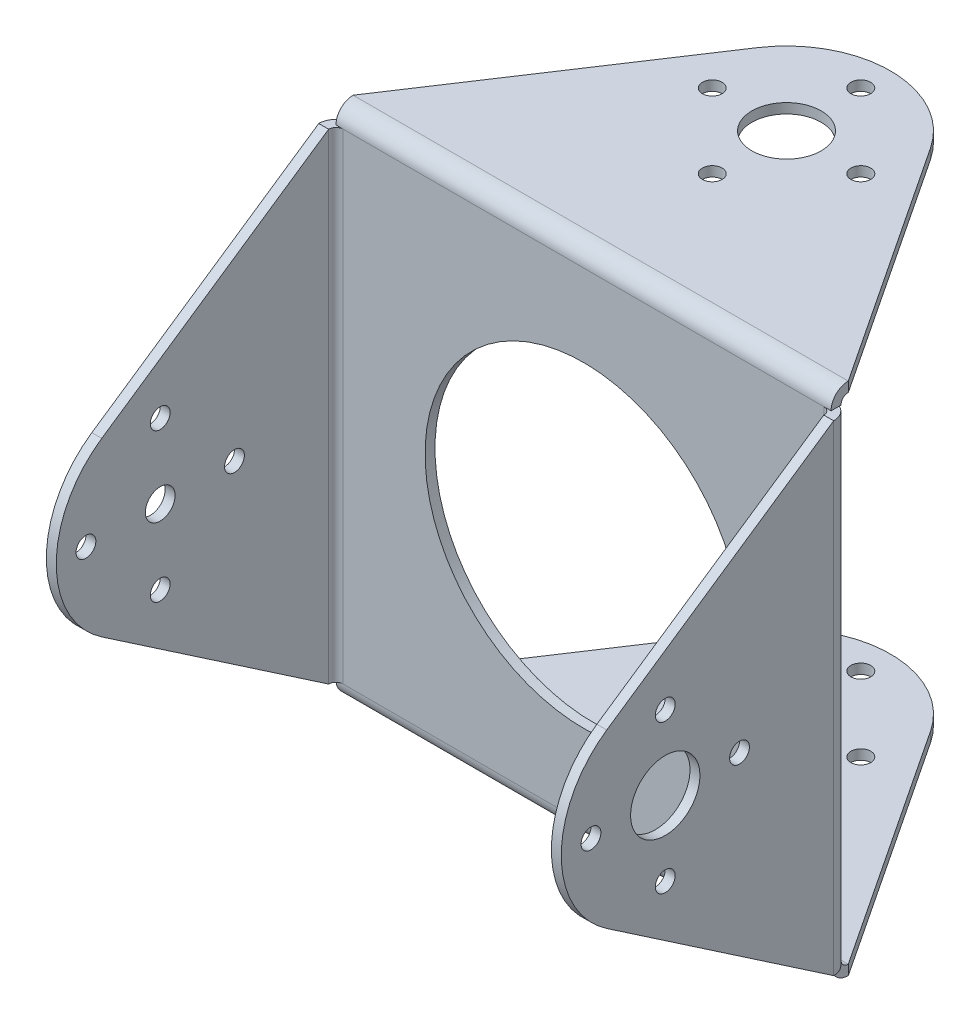
from build123d import *

# Parameters (mm, degrees)
SKETCH_1_W                         = 50
SKETCH_1_H                         = 50
SKETCH_1_R                         = 16
SM_BASE_FLANGE_1_DEPTH             = 1
SM_EDGE_FLANGE_1_STRIP_W           = 5.4732
SM_EDGE_FLANGE_1_STRIP_H           = 1
SM_EDGE_FLANGE_1_STRIP_CUT_DEPTH   = 50
SM_EDGE_FLANGE_1_STRIP_2_W         = 5.4732
SM_EDGE_FLANGE_1_STRIP_2_H         = 1
SM_EDGE_FLANGE_1_STRIP_CUT_2_DEPTH = 50
SM_EDGE_FLANGE_1_DEPTH             = 50
SM_EDGE_FLANGE_1_BEND_DEPTH        = 50
SM_EDGE_FLANGE_2_STRIP_W           = 5.4732
SM_EDGE_FLANGE_2_STRIP_H           = 1
SM_EDGE_FLANGE_2_STRIP_CUT_DEPTH   = 48.5268
SM_EDGE_FLANGE_2_STRIP_2_W         = 5.4732
SM_EDGE_FLANGE_2_STRIP_2_H         = 1
SM_EDGE_FLANGE_2_STRIP_CUT_2_DEPTH = 48.5268
SM_EDGE_FLANGE_2_DEPTH             = 48.5268
SM_EDGE_FLANGE_2_BEND_DEPTH        = 48.5268
SKETCH_23_R                        = 1
CUT_EXTRUDE_1_DEPTH                = 98
CUT_EXTRUDE_3_REACH                = 67.886
SKETCH_27_R                        = 3.5
SKETCH_27_R_2                      = 1
EXTRUDE_START                      = -1
SKETCH_30_R                        = 3.5
SKETCH_30_R_2                      = 1.5
EXTRUDE_1_DEPTH                    = 1
SKETCH_33_R                        = 3.5
EXTRUDE_2_DEPTH                    = 1
SKETCH_36_R                        = 1.5
CUT_EXTRUDE_4_DEPTH                = 1


# Sheet-metal steps are written as plain solids
with BuildPart() as part:
    # Sketch 1 → 基材-凸緣1 (new body)
    with BuildSketch(Plane.XY):
        Rectangle(SKETCH_1_W, SKETCH_1_H)
        Circle(SKETCH_1_R, mode=Mode.SUBTRACT)
    extrude(amount=-SM_BASE_FLANGE_1_DEPTH)

    # 邊線-凸緣1 strip (across the edge) → 邊線-凸緣1 strip cut (cut)
    with BuildSketch(Plane(origin=(-25, 25, -1), x_dir=(0, -1, 0), z_dir=(1, 0, 0))):
        with Locations((-2, -0.5)):
            Rectangle(SM_EDGE_FLANGE_1_STRIP_W, SM_EDGE_FLANGE_1_STRIP_H)
    extrude(amount=SM_EDGE_FLANGE_1_STRIP_CUT_DEPTH, mode=Mode.SUBTRACT)

    # 邊線-凸緣1 strip 2 (across the edge) → 邊線-凸緣1 strip cut 2 (cut)
    with BuildSketch(Plane(origin=(25, -25, -1), x_dir=(0, 1, 0), z_dir=(-1, 0, 0))):
        with Locations((-2, -0.5)):
            Rectangle(SM_EDGE_FLANGE_1_STRIP_2_W, SM_EDGE_FLANGE_1_STRIP_2_H)
    extrude(amount=SM_EDGE_FLANGE_1_STRIP_CUT_2_DEPTH, mode=Mode.SUBTRACT)

    # 邊線-凸緣1 section (across the edge) → 邊線-凸緣1 (add)
    with BuildSketch(Plane(origin=(-25, 25, -1), x_dir=(0, -1, 0), z_dir=(1, 0, 0))):
        with BuildLine():
            Line((-1, 0.7366), (-1, 30))
            Line((-1, 30), (0, 30))
            Line((0, 30), (0, 0.7366))
            ThreePointArc((0, 0.7366), (0.215745145, 0.215745145), (0.7366, 0))
            Line((0.7366, 0), (0.7366, -1))
            ThreePointArc((0.7366, -1), (-0.491361636, -0.491361636), (-1, 0.7366))
        make_face()
    extrude(amount=SM_EDGE_FLANGE_1_DEPTH)

    # 邊線-凸緣1 section 2 (across the edge) → 邊線-凸緣1 bend (add)
    with BuildSketch(Plane(origin=(25, -25, -1), x_dir=(0, 1, 0), z_dir=(-1, 0, 0))):
        with BuildLine():
            Line((-1, 0.7366), (-1, 30))
            Line((-1, 30), (0, 30))
            Line((0, 30), (0, 0.7366))
            ThreePointArc((0, 0.7366), (0.215745145, 0.215745145), (0.7366, 0))
            Line((0.7366, 0), (0.7366, -1))
            ThreePointArc((0.7366, -1), (-0.491361636, -0.491361636), (-1, 0.7366))
        make_face()
    extrude(amount=SM_EDGE_FLANGE_1_BEND_DEPTH)

    # 邊線-凸緣2 strip (across the edge) → 邊線-凸緣2 strip cut (cut)
    with BuildSketch(Plane(origin=(25, -24.2634, 0), x_dir=(-1, 0, 0), z_dir=(0, 1, 0))):
        with Locations((-2, -0.5)):
            Rectangle(SM_EDGE_FLANGE_2_STRIP_W, SM_EDGE_FLANGE_2_STRIP_H)
    extrude(amount=SM_EDGE_FLANGE_2_STRIP_CUT_DEPTH, mode=Mode.SUBTRACT)

    # 邊線-凸緣2 strip 2 (across the edge) → 邊線-凸緣2 strip cut 2 (cut)
    with BuildSketch(Plane(origin=(-25, 24.2634, 0), x_dir=(1, 0, 0), z_dir=(0, -1, 0))):
        with Locations((-2, -0.5)):
            Rectangle(SM_EDGE_FLANGE_2_STRIP_2_W, SM_EDGE_FLANGE_2_STRIP_2_H)
    extrude(amount=SM_EDGE_FLANGE_2_STRIP_CUT_2_DEPTH, mode=Mode.SUBTRACT)

    # 邊線-凸緣2 section (across the edge) → 邊線-凸緣2 (add)
    with BuildSketch(Plane(origin=(25, -24.2634, 0), x_dir=(-1, 0, 0), z_dir=(0, 1, 0))):
        with BuildLine():
            Line((-1, 0.7366), (-1, 30))
            Line((-1, 30), (0, 30))
            Line((0, 30), (0, 0.7366))
            ThreePointArc((0, 0.7366), (0.215745145, 0.215745145), (0.7366, 0))
            Line((0.7366, 0), (0.7366, -1))
            ThreePointArc((0.7366, -1), (-0.491361636, -0.491361636), (-1, 0.7366))
        make_face()
    extrude(amount=SM_EDGE_FLANGE_2_DEPTH)

    # 邊線-凸緣2 section 2 (across the edge) → 邊線-凸緣2 bend (add)
    with BuildSketch(Plane(origin=(-25, 24.2634, 0), x_dir=(1, 0, 0), z_dir=(0, -1, 0))):
        with BuildLine():
            Line((-1, 0.7366), (-1, 30))
            Line((-1, 30), (0, 30))
            Line((0, 30), (0, 0.7366))
            ThreePointArc((0, 0.7366), (0.215745145, 0.215745145), (0.7366, 0))
            Line((0.7366, 0), (0.7366, -1))
            ThreePointArc((0.7366, -1), (-0.491361636, -0.491361636), (-1, 0.7366))
        make_face()
    extrude(amount=SM_EDGE_FLANGE_2_BEND_DEPTH)

    # 草圖23 → 除料-伸長1 (cut)
    with BuildSketch(Plane(origin=(0, 26, 0), x_dir=(1, 0, 0), z_dir=(0, 1, 0))):
        with BuildLine():
            Line((25, 31), (0, 31))
            ThreePointArc((0, 31), (4.971280899, 29.748587256), (8.757585745, 26.292641186))
            Line((8.757585745, 26.292641186), (25, 1.7366))
            Line((25, 1.7366), (25, 31))
        make_face()
        with BuildLine():
            ThreePointArc((-8.757585745, 26.292641186), (-4.971280899, 29.748587256), (0, 31))
            Line((0, 31), (-25, 31))
            Line((-25, 31), (-25, 1.7366))
            Line((-25, 1.7366), (-8.757585745, 26.292641186))
        make_face()
        with BuildLine():
            ThreePointArc((1, 28), (0.707106781, 28.707106781), (0, 29))
            Line((0, 29), (0, 27))
            ThreePointArc((0, 27), (0.707106781, 27.292893219), (1, 28))
        make_face()
        with BuildLine():
            Line((0, 27), (0, 29))
            ThreePointArc((0, 29), (-1, 28), (0, 27))
        make_face()
        with Locations(Location((-7.5, 20.5, 0), (0, 0, 90))):
            Circle(SKETCH_23_R)
        with Locations(Location((7.5, 20.5, 0), (0, 0, 90))):
            Circle(SKETCH_23_R)
        with BuildLine():
            ThreePointArc((1, 13), (0.707106781, 13.707106781), (0, 14))
            Line((0, 14), (0, 12))
            ThreePointArc((0, 12), (0.707106781, 12.292893219), (1, 13))
        make_face()
        with BuildLine():
            Line((0, 12), (0, 14))
            ThreePointArc((0, 14), (-1, 13), (0, 12))
        make_face()
        with BuildLine():
            ThreePointArc((3.5, 20.5), (2.474873734, 22.974873734), (0, 24))
            Line((0, 24), (0, 17))
            ThreePointArc((0, 17), (2.474873734, 18.025126266), (3.5, 20.5))
        make_face()
        with BuildLine():
            Line((0, 17), (0, 24))
            ThreePointArc((0, 24), (-3.5, 20.5), (0, 17))
        make_face()
    extrude(amount=-CUT_EXTRUDE_1_DEPTH, mode=Mode.SUBTRACT)

    # 除料-伸長3: up to this face of the body (flat: up to its plane)
    cut_extrude_3_end = Plane(part.part.faces().sort_by_distance((-26, 0, 15.3683))[0])
    # 草圖27 → 除料-伸長3 (cut, up to the picked face)
    with BuildSketch(Plane(origin=(26, 0, 0), x_dir=(0, 0, -1), z_dir=(1, 0, 0)), mode=Mode.PRIVATE) as cut_extrude_3_sk1:
        with BuildLine():
            Line((-30, -24.2634), (-0.7366, -24.2634))
            Line((-0.7366, -24.2634), (-23.651269893, -8.68300712))
            ThreePointArc((-23.651269893, -8.68300712), (-28.24742476, 0), (-23.651269893, 8.68300712))
            Line((-23.651269893, 8.68300712), (-0.7366, 24.2634))
            Line((-0.7366, 24.2634), (-30, 24.2634))
            Line((-30, 24.2634), (-30, -24.2634))
        make_face()
    cut_extrude_3_tool1 = split(extrude(cut_extrude_3_sk1.sketch, amount=-CUT_EXTRUDE_3_REACH, mode=Mode.PRIVATE), bisect_by=cut_extrude_3_end, keep=Keep.BOTH, mode=Mode.PRIVATE)
    # 草圖27 → 除料-伸長3 (cut, up to the picked face)
    with BuildSketch(Plane(origin=(26, 0, 0), x_dir=(0, 0, -1), z_dir=(1, 0, 0)), mode=Mode.PRIVATE) as cut_extrude_3_sk2:
        with Locations(Location((-17.74742476, 0, 0), (0, 0, 180))):
            Circle(SKETCH_27_R)
    cut_extrude_3_tool2 = split(extrude(cut_extrude_3_sk2.sketch, amount=-CUT_EXTRUDE_3_REACH, mode=Mode.PRIVATE), bisect_by=cut_extrude_3_end, keep=Keep.BOTH, mode=Mode.PRIVATE)
    # 草圖27 → 除料-伸長3 (cut, up to the picked face)
    with BuildSketch(Plane(origin=(26, 0, 0), x_dir=(0, 0, -1), z_dir=(1, 0, 0)), mode=Mode.PRIVATE) as cut_extrude_3_sk3:
        with Locations(Location((-17.74742476, -7.5, 0), (0, 0, 180))):
            Circle(SKETCH_27_R_2)
    cut_extrude_3_tool3 = split(extrude(cut_extrude_3_sk3.sketch, amount=-CUT_EXTRUDE_3_REACH, mode=Mode.PRIVATE), bisect_by=cut_extrude_3_end, keep=Keep.BOTH, mode=Mode.PRIVATE)
    # 草圖27 → 除料-伸長3 (cut, up to the picked face)
    with BuildSketch(Plane(origin=(26, 0, 0), x_dir=(0, 0, -1), z_dir=(1, 0, 0)), mode=Mode.PRIVATE) as cut_extrude_3_sk4:
        with Locations(Location((-25.24742476, 0, 0), (0, 0, 180))):
            Circle(SKETCH_27_R_2)
    cut_extrude_3_tool4 = split(extrude(cut_extrude_3_sk4.sketch, amount=-CUT_EXTRUDE_3_REACH, mode=Mode.PRIVATE), bisect_by=cut_extrude_3_end, keep=Keep.BOTH, mode=Mode.PRIVATE)
    # 草圖27 → 除料-伸長3 (cut, up to the picked face)
    with BuildSketch(Plane(origin=(26, 0, 0), x_dir=(0, 0, -1), z_dir=(1, 0, 0)), mode=Mode.PRIVATE) as cut_extrude_3_sk5:
        with Locations(Location((-17.74742476, 7.5, 0), (0, 0, 180))):
            Circle(SKETCH_27_R_2)
    cut_extrude_3_tool5 = split(extrude(cut_extrude_3_sk5.sketch, amount=-CUT_EXTRUDE_3_REACH, mode=Mode.PRIVATE), bisect_by=cut_extrude_3_end, keep=Keep.BOTH, mode=Mode.PRIVATE)
    # 草圖27 → 除料-伸長3 (cut, up to the picked face)
    with BuildSketch(Plane(origin=(26, 0, 0), x_dir=(0, 0, -1), z_dir=(1, 0, 0)), mode=Mode.PRIVATE) as cut_extrude_3_sk6:
        with Locations(Location((-10.24742476, 0, 0), (0, 0, 180))):
            Circle(SKETCH_27_R_2)
    cut_extrude_3_tool6 = split(extrude(cut_extrude_3_sk6.sketch, amount=-CUT_EXTRUDE_3_REACH, mode=Mode.PRIVATE), bisect_by=cut_extrude_3_end, keep=Keep.BOTH, mode=Mode.PRIVATE)
    add(cut_extrude_3_tool1.solids().sort_by(Axis((26, -23.696726, 15.3683), (-1, 0, 0)))[0], mode=Mode.SUBTRACT)
    add(cut_extrude_3_tool2.solids().sort_by(Axis((26, 0, 17.747425), (-1, 0, 0)))[0], mode=Mode.SUBTRACT)
    add(cut_extrude_3_tool3.solids().sort_by(Axis((26, -7.5, 17.747425), (-1, 0, 0)))[0], mode=Mode.SUBTRACT)
    add(cut_extrude_3_tool4.solids().sort_by(Axis((26, 0, 25.247425), (-1, 0, 0)))[0], mode=Mode.SUBTRACT)
    add(cut_extrude_3_tool5.solids().sort_by(Axis((26, 7.5, 17.747425), (-1, 0, 0)))[0], mode=Mode.SUBTRACT)
    add(cut_extrude_3_tool6.solids().sort_by(Axis((26, 0, 10.247425), (-1, 0, 0)))[0], mode=Mode.SUBTRACT)

    # 草圖30 → 填料-伸長1 (add)
    with BuildSketch(Plane.XZ.offset(26).offset(EXTRUDE_START)):
        with Locations(Location((0, -20.5, 0), (0, 0, 270))):
            Circle(SKETCH_30_R)
        with Locations(Location((0, -20.5, 0), (0, 0, 270))):
            Circle(SKETCH_30_R_2, mode=Mode.SUBTRACT)
    extrude(amount=EXTRUDE_1_DEPTH)

    # 草圖33 → 填料-伸長2 (add)
    with BuildSketch(Plane.ZY.offset(26).offset(EXTRUDE_START)):
        with Locations((17.74742476, 0)):
            Circle(SKETCH_33_R)
    extrude(amount=EXTRUDE_2_DEPTH)

    # 草圖36 → 除料-伸長4 (cut)
    with BuildSketch(Plane.ZY.offset(26)):
        with Locations((17.74742476, 0)):
            Circle(SKETCH_36_R)
    extrude(amount=-CUT_EXTRUDE_4_DEPTH, mode=Mode.SUBTRACT)


solid = part.part
